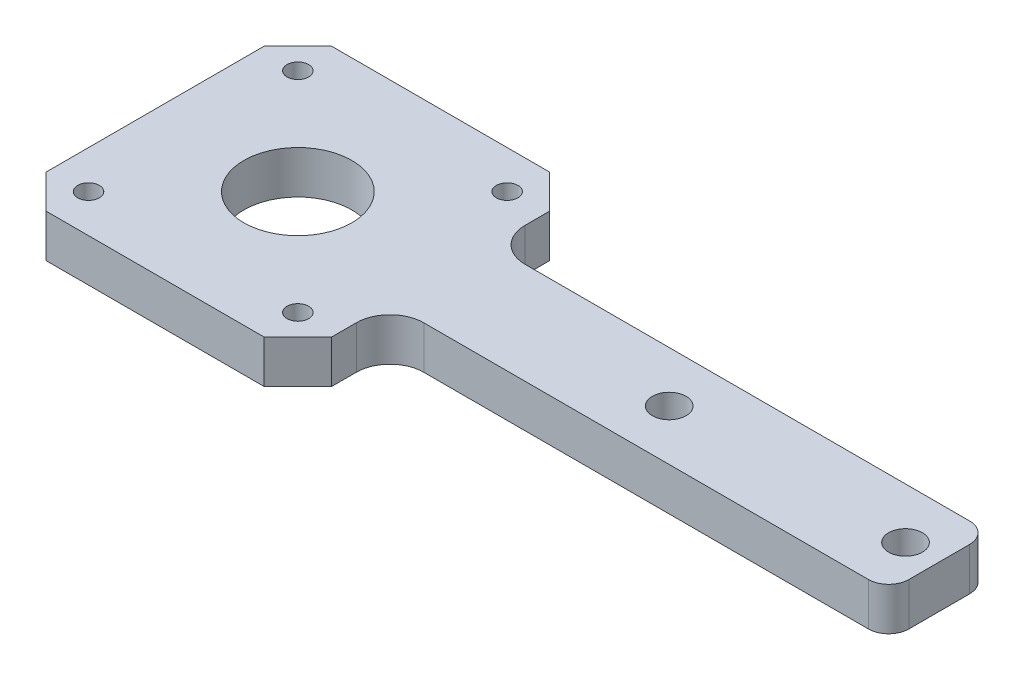
from build123d import *

# Parameters (mm, degrees)
SKETCH1_R           = 1.6
SKETCH1_R_2         = 8
SKETCH1_R_3         = 2.5
BOSS_EXTRUDE2_DEPTH = 6.35
CHAMFER2_SIZE       = 5
FILLET1_R           = 3
FILLET2_R           = 5


with BuildPart() as part:
    # Sketch1 → Boss-Extrude2 (new body)
    with BuildSketch(Plane(origin=(0, 0, 0), x_dir=(1, 0, 0), z_dir=(0, 1, 0))):
        Polygon((-21.15, 21.15), (21.15, 21.15), (21.15, 7.5), (95, 7.5), (95, -7.5), (21.15, -7.5), (21.15, -21.15), (-21.15, -21.15), align=None)
        with Locations((-15.5, 15.5)):
            Circle(SKETCH1_R, mode=Mode.SUBTRACT)
        with Locations((15.5, 15.5)):
            Circle(SKETCH1_R, mode=Mode.SUBTRACT)
        with Locations((15.5, -15.5)):
            Circle(SKETCH1_R, mode=Mode.SUBTRACT)
        with Locations((-15.5, -15.5)):
            Circle(SKETCH1_R, mode=Mode.SUBTRACT)
        Circle(SKETCH1_R_2, mode=Mode.SUBTRACT)
        with Locations((90, 0)):
            Circle(SKETCH1_R_3, mode=Mode.SUBTRACT)
        with Locations((55, 0)):
            Circle(SKETCH1_R_3, mode=Mode.SUBTRACT)
    extrude(amount=BOSS_EXTRUDE2_DEPTH)

    # Chamfer2
    chamfer2_edges = [part.edges().sort_by_distance(p)[0] for p in [
        (-21.15, 3.175, -21.15),
        (21.15, 3.175, -21.15),
        (21.15, 3.175, 21.15),
        (-21.15, 3.175, 21.15),
    ]]
    chamfer(chamfer2_edges, length=CHAMFER2_SIZE)

    # Fillet1
    fillet1_edges = [part.edges().sort_by_distance(p)[0] for p in [
        (95, 3.175, -7.5),
        (95, 3.175, 7.5),
    ]]
    fillet(fillet1_edges, radius=FILLET1_R)

    # Fillet2
    fillet2_edges = [part.edges().sort_by_distance(p)[0] for p in [
        (21.15, 3.175, -7.5),
        (21.15, 3.175, 7.5),
    ]]
    fillet(fillet2_edges, radius=FILLET2_R)


solid = part.part
